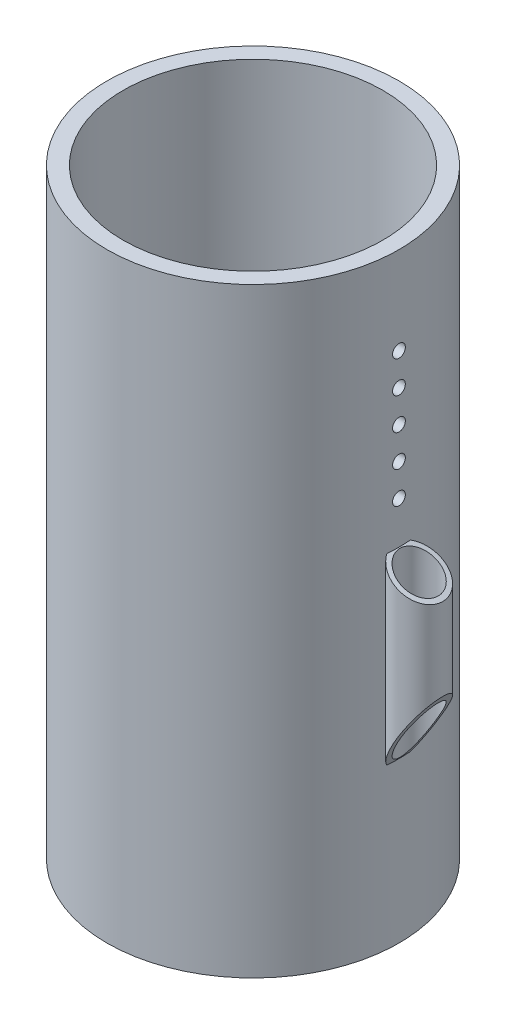
from build123d import *

# Parameters (mm, degrees)
SKETCH1_R           = 11.43
SKETCH1_R_2         = 10.16
BOSS_EXTRUDE1_DEPTH = 46.99
BOSS_EXTRUDE2_START = 20
SKETCH3_R           = 1.85
SKETCH3_R_2         = 1.5
BOSS_EXTRUDE2_DEPTH = 2.5
CHAMFER4_SIZE       = 7.5
CHAMFER4_SIZE_2     = 4.330127019
CHAMFER5_SIZE       = 7.5
CHAMFER5_SIZE_2     = 4.330127019
SKETCH4_R           = 0.5
CUT_EXTRUDE1_DEPTH  = 5


with BuildPart() as part:
    # Sketch1 → Boss-Extrude1 (new body)
    with BuildSketch(Plane(origin=(0, 0, 0), x_dir=(1, 0, 0), z_dir=(0, 1, 0))):
        with Locations(Location((0, 0, 0), (0, 0, 270))):
            Circle(SKETCH1_R)
        with Locations(Location((0, 0, 0), (0, 0, 270))):
            Circle(SKETCH1_R_2, mode=Mode.SUBTRACT)
    extrude(amount=BOSS_EXTRUDE1_DEPTH)

    # Sketch3 → Boss-Extrude2 (add)
    with BuildSketch(Plane(origin=(0, 0, 0), x_dir=(1, 0, 0), z_dir=(0, 1, 0)).offset(BOSS_EXTRUDE2_START)):
        with Locations((13, 0)):
            Circle(SKETCH3_R)
        with Locations(Location((13, 0, 0), (0, 0, 270))):
            Circle(SKETCH3_R_2, mode=Mode.SUBTRACT)
    extrude(amount=BOSS_EXTRUDE2_DEPTH)

    # Chamfer4
    # the kernel refuses this chamfer: 7.5, 4.330127019 mm, written as the material it adds along each edge
    with BuildSketch(Plane(origin=(0, 20, 0), x_dir=(-0.2055966456613654, 0, -0.9786368168492308), z_dir=(-0.9786368168492308, 0, 0.2055966456613654))) as chamfer4_piece_1_section:
        Polygon((11.43, CHAMFER4_SIZE), (11.43 + CHAMFER4_SIZE_2, 0), (11.43, 0), align=None)
    chamfer4_piece_1 = revolve(axis=Axis((0, 20, 0), (0, -1, 0)), revolution_arc=203.728856682, mode=Mode.PRIVATE)
    chamfer4_piece_1 = chamfer4_piece_1 - Plane(origin=(13, 13.499486396, 0), x_dir=(0, 0, 1), z_dir=(0, -1, 0)) * Cylinder(1.5, 64, mode=Mode.PRIVATE)
    chamfer4_piece_1 = chamfer4_piece_1 & Plane(origin=(13, 13.499486396, 0), x_dir=(1, 0, 0), z_dir=(0, -1, 0)) * Cylinder(1.85, 64, mode=Mode.PRIVATE)
    add(chamfer4_piece_1)

    # Chamfer5
    # the kernel refuses this chamfer: 7.5, 4.330127019 mm, written as the material it adds along each edge
    with BuildSketch(Plane(origin=(0, 22.5, 0), x_dir=(-0.20559664566136496, 0, -0.9786368168492309), z_dir=(-0.9786368168492309, 0, 0.20559664566136496))) as chamfer5_piece_1_section:
        Polygon((11.43 + CHAMFER5_SIZE, 0), (11.43, -CHAMFER5_SIZE_2), (11.43, 0), align=None)
    chamfer5_piece_1 = revolve(axis=Axis((0, 22.5, 0), (0, -1, 0)), revolution_arc=203.728856682, mode=Mode.PRIVATE)
    chamfer5_piece_1 = chamfer5_piece_1 - Plane(origin=(13, 25.165434587, 0), x_dir=(0, 0, 1), z_dir=(0, -1, 0)) * Cylinder(1.5, 76, mode=Mode.PRIVATE)
    chamfer5_piece_1 = chamfer5_piece_1 & Plane(origin=(13, 25.165434587, 0), x_dir=(1, 0, 0), z_dir=(0, -1, 0)) * Cylinder(1.85, 76, mode=Mode.PRIVATE)
    add(chamfer5_piece_1)

    # Sketch4 → Cut-Extrude1 (cut)
    with BuildSketch(Plane(origin=(11.43, 0, 0), x_dir=(0, 0, -1), z_dir=(1, 0, 0))):
        with Locations((0, 30.132630437)):
            Circle(SKETCH4_R)
        with Locations((0, 32.632630437)):
            Circle(SKETCH4_R)
        with Locations((0, 35.132630437)):
            Circle(SKETCH4_R)
        with Locations((0, 37.632630437)):
            Circle(SKETCH4_R)
        with Locations((0, 40.132630437)):
            Circle(SKETCH4_R)
    extrude(amount=-CUT_EXTRUDE1_DEPTH, mode=Mode.SUBTRACT)


solid = part.part
